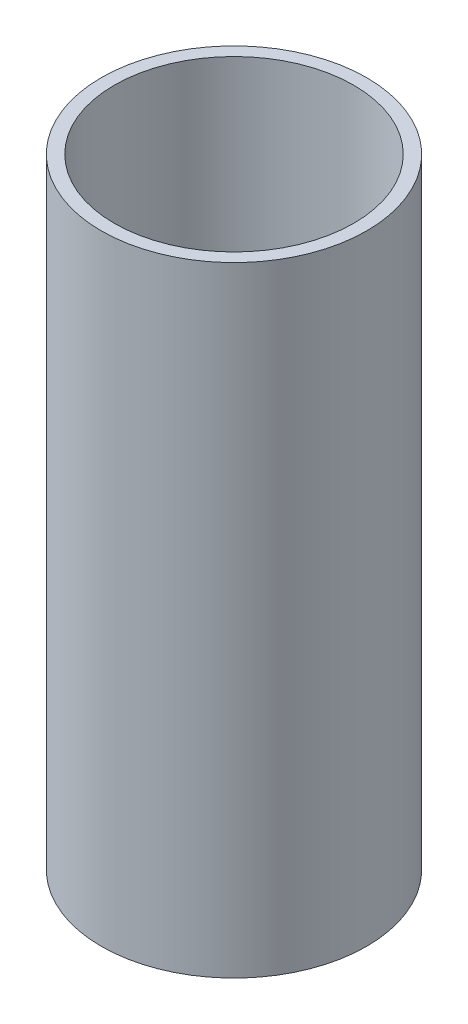
from build123d import *

# Parameters (mm, degrees)
SKETCH1_R           = 42.5
BOSS_EXTRUDE1_DEPTH = 198.436822394
SKETCH2_R           = 38.335053037
CUT_EXTRUDE1_DEPTH  = 208.33951018


with BuildPart() as part:
    # Sketch1 → Boss-Extrude1 (new body)
    with BuildSketch(Plane(origin=(0, 0, 0), x_dir=(1, 0, 0), z_dir=(0, 1, 0))):
        Circle(SKETCH1_R)
    extrude(amount=BOSS_EXTRUDE1_DEPTH)

    # Sketch2 → Cut-Extrude1 (cut, through all)
    with BuildSketch(Plane(origin=(0, 0, 0), x_dir=(1, 0, 0), z_dir=(0, 1, 0))):
        Circle(SKETCH2_R)
    extrude(amount=CUT_EXTRUDE1_DEPTH, mode=Mode.SUBTRACT)


solid = part.part
